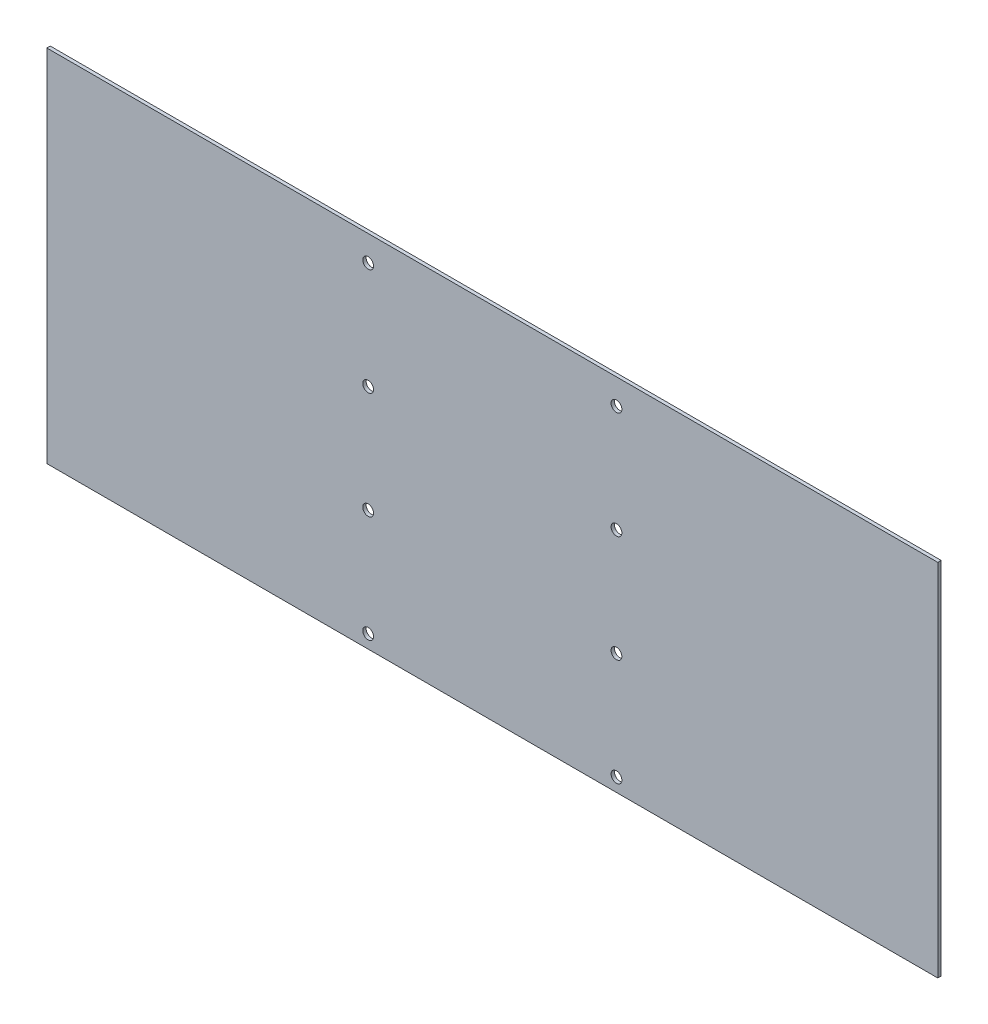
from build123d import *

# Parameters (mm, degrees)
CROQUIS1_W                    = 832.4
CROQUIS1_H                    = 336.3
BRIDA_BASE1_DEPTH             = 3.175
TALADRO_DE_MARGEN_PARA_3_81_D = 10.0838


# Sheet-metal steps are written as plain solids
with BuildPart() as part:
    # Croquis1 → Brida base1 (new body)
    with BuildSketch(Plane.XY):
        with Locations((75.271401719, 33.386549165)):
            Rectangle(CROQUIS1_W, CROQUIS1_H)
    extrude(amount=-BRIDA_BASE1_DEPTH)

    # Taladro de margen para 3/81 (through all)
    with Locations(Plane.XY):
        with Locations((-40.728598281, 77.736549165), (-40.728598281, -22.263450835), (191.271401719, 77.736549165), (191.271401719, -22.263450835), (-40.728598281, -122.263450835), (191.271401719, -122.263450835), (191.271401719, 177.736549165), (-40.728598281, 177.736549165)):
            Hole(TALADRO_DE_MARGEN_PARA_3_81_D / 2)


solid = part.part
